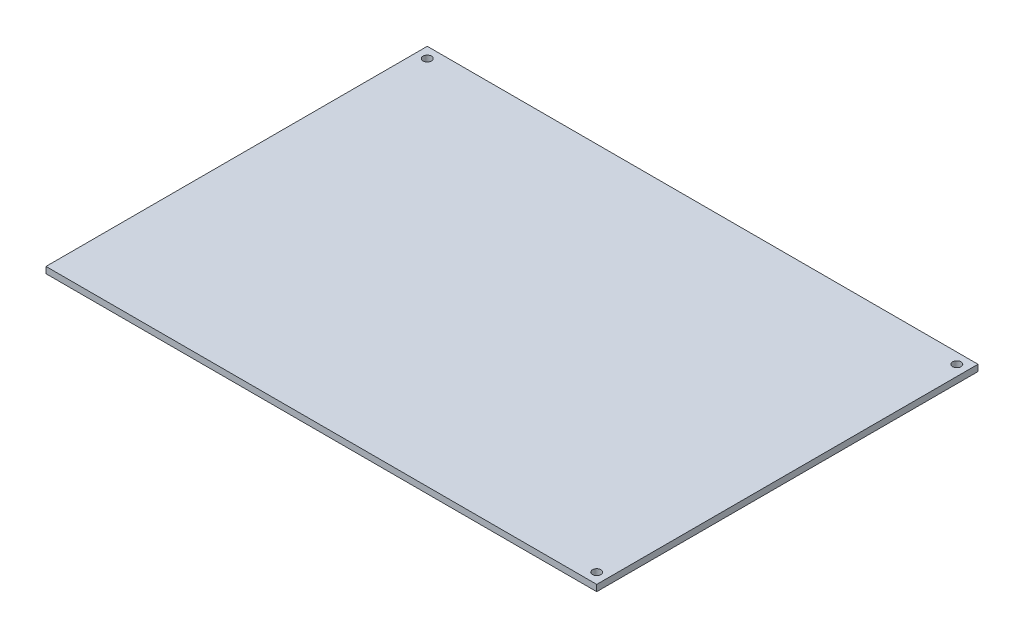
from build123d import *

# Parameters (mm, degrees)
SKETCH1_W           = 260
SKETCH1_H           = 180
BOSS_EXTRUDE1_DEPTH = 3
SKETCH2_R           = 2
CUT_EXTRUDE1_DEPTH  = 159.142340946


with BuildPart() as part:
    # Sketch1 → Boss-Extrude1 (new body)
    with BuildSketch(Plane(origin=(0, 0, 0), x_dir=(1, 0, 0), z_dir=(0, 1, 0))):
        Rectangle(SKETCH1_W, SKETCH1_H)
    extrude(amount=BOSS_EXTRUDE1_DEPTH)

    # Sketch2 → Cut-Extrude1 (cut, through all)
    with BuildSketch(Plane(origin=(0, 3, 0), x_dir=(1, 0, 0), z_dir=(0, 1, 0))):
        with Locations((125, -85)):
            Circle(SKETCH2_R)
        with Locations((125, 85)):
            Circle(SKETCH2_R)
        with Locations((-125, 85)):
            Circle(SKETCH2_R)
    extrude(amount=-CUT_EXTRUDE1_DEPTH, mode=Mode.SUBTRACT)


solid = part.part
